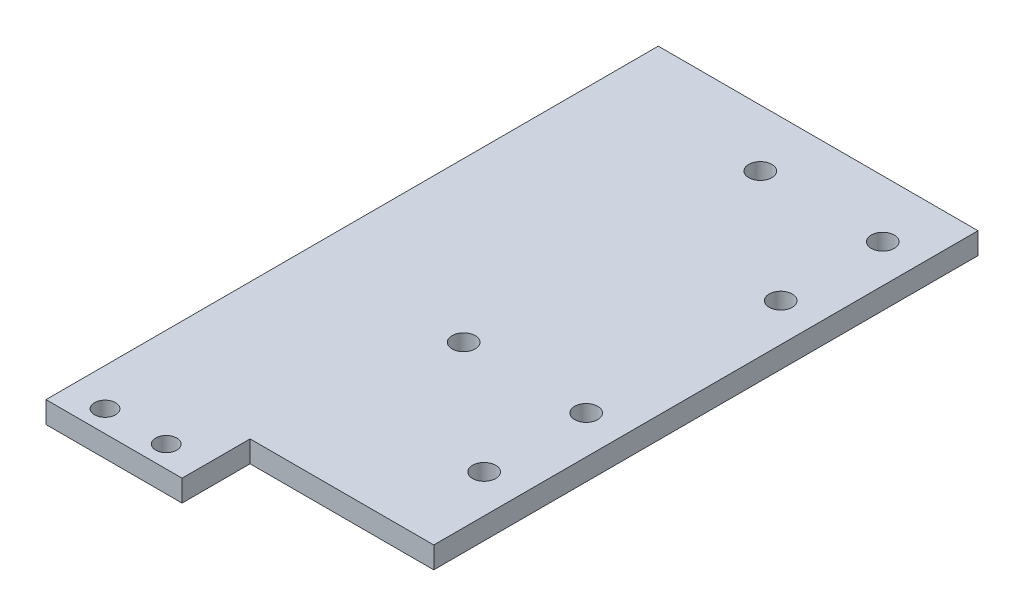
from build123d import *

# Parameters (mm, degrees)
SKETCH1_R           = 1.7
SKETCH1_R_2         = 1.55
BOSS_EXTRUDE1_DEPTH = 3.175


with BuildPart() as part:
    # Sketch1 → Boss-Extrude1 (new body)
    with BuildSketch(Plane(origin=(0, 0, 0), x_dir=(1, 0, 0), z_dir=(0, 1, 0))):
        Polygon((0, 0), (0, 90), (47, 90), (47, 10), (20, 10), (20, 0), align=None)
        with Locations((41.4, 81.6)):
            Circle(SKETCH1_R, mode=Mode.SUBTRACT)
        with Locations((14.5, 3.175)):
            Circle(SKETCH1_R_2, mode=Mode.SUBTRACT)
        with Locations((23.4, 81.6)):
            Circle(SKETCH1_R, mode=Mode.SUBTRACT)
        with Locations((5.5, 3.175)):
            Circle(SKETCH1_R_2, mode=Mode.SUBTRACT)
        with Locations((41.4, 23)):
            Circle(SKETCH1_R, mode=Mode.SUBTRACT)
        with Locations((41.4, 38)):
            Circle(SKETCH1_R, mode=Mode.SUBTRACT)
        with Locations((23.4, 38)):
            Circle(SKETCH1_R, mode=Mode.SUBTRACT)
        with Locations((41.4, 66.6)):
            Circle(SKETCH1_R, mode=Mode.SUBTRACT)
    extrude(amount=BOSS_EXTRUDE1_DEPTH)


solid = part.part
